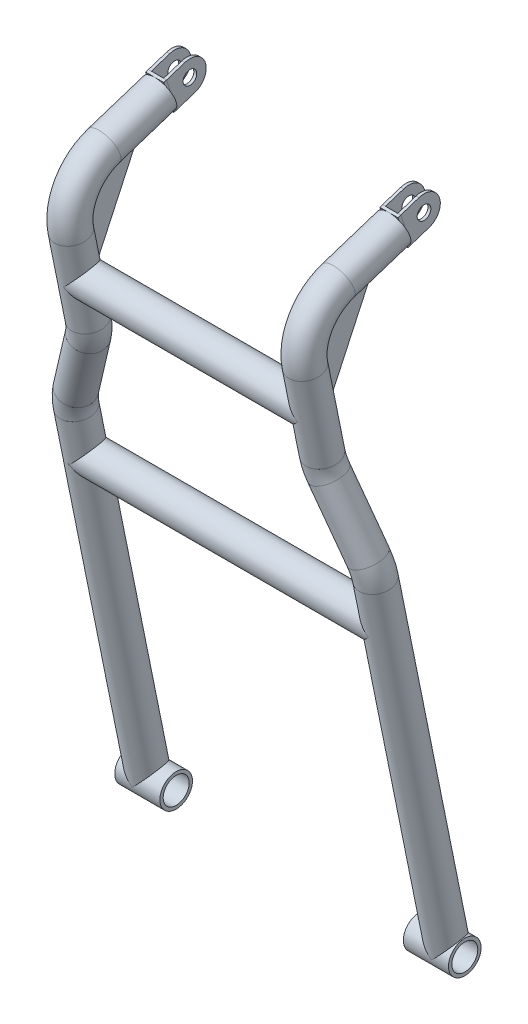
from build123d import *

# Parameters (mm, degrees)
SALIENTE_EXTRUIR2_DEPTH             = 17.7
SALIENTE_EXTRUIR2_DEPTH_BACK        = 28.6
CROQUIS9_R                          = 16.7
CROQUIS9_R_2                        = 13.32
CROQUIS17_R                         = 7
SALIENTE_EXTRUIR3_DEPTH             = 3
SALIENTE_EXTRUIR4_DEPTH             = 18.6
CROQUIS28_R                         = 7
SALIENTE_EXTRUIR6_DEPTH             = 3
MIEMBRO_START                       = 115.013486238
MIEMBRO_ESTRUCTURAL2_OUTLINE_R      = 16.7005
MIEMBRO_ESTRUCTURAL2_OUTLINE_R_2    = 13.3223
MIEMBRO_ESTRUCTURAL2_DEPTH          = 60
MIEMBRO_ESTRUCTURAL2_2_OUTLINE_R    = 16.7005
MIEMBRO_ESTRUCTURAL2_2_OUTLINE_R_2  = 13.3223
MIEMBRO_ESTRUCTURAL2_2_ANGLE        = 83.467742
MIEMBRO_START_2                     = 478.845731153
MIEMBRO_ESTRUCTURAL2_3_OUTLINE_R    = 16.7005
MIEMBRO_ESTRUCTURAL2_3_OUTLINE_R_2  = 13.3223
MIEMBRO_ESTRUCTURAL2_3_DEPTH        = 88.50498695
MIEMBRO_ESTRUCTURAL2_4_OUTLINE_R    = 16.7005
MIEMBRO_ESTRUCTURAL2_4_OUTLINE_R_2  = 13.3223
MIEMBRO_ESTRUCTURAL2_4_ANGLE        = 20.838652
MIEMBRO_START_3                     = -386.762506434
MIEMBRO_ESTRUCTURAL2_5_OUTLINE_R    = 16.7005
MIEMBRO_ESTRUCTURAL2_5_OUTLINE_R_2  = 13.3223
MIEMBRO_ESTRUCTURAL2_5_DEPTH        = 74.28752144
MIEMBRO_ESTRUCTURAL2_6_OUTLINE_R    = 16.7005
MIEMBRO_ESTRUCTURAL2_6_OUTLINE_R_2  = 13.3223
MIEMBRO_ESTRUCTURAL2_6_ANGLE        = 20.838652
MIEMBRO_ESTRUCTURAL2_7_OUTLINE_R    = 16.7005
MIEMBRO_ESTRUCTURAL2_7_OUTLINE_R_2  = 13.3223
MIEMBRO_ESTRUCTURAL2_7_DEPTH        = 371.496041626
MIEMBRO_START_4                     = -154.6
MIEMBRO_ESTRUCTURAL2_8_OUTLINE_R    = 16.7005
MIEMBRO_ESTRUCTURAL2_8_OUTLINE_R_2  = 13.3223
MIEMBRO_ESTRUCTURAL2_8_DEPTH        = 308.0000001
MIEMBRO_ESTRUCTURAL2_9_OUTLINE_W    = 16.7005
MIEMBRO_ESTRUCTURAL2_9_OUTLINE_H    = 33.514710476
MIEMBRO_START_5                     = -120
MIEMBRO_ESTRUCTURAL2_10_OUTLINE_R   = 16.7005
MIEMBRO_ESTRUCTURAL2_10_OUTLINE_R_2 = 13.3223
MIEMBRO_ESTRUCTURAL2_10_DEPTH       = 240.0000001
MIEMBRO_START_6                     = 505
MIEMBRO_ESTRUCTURAL2_11_DEPTH       = 36
SIMETR_A10_2_ANGLE                  = 180
SIMETR_A10_3_ANGLE                  = 172.2878654
SIMETR_A10_4_ANGLE                  = 180
SALIENTE_EXTRUIR7_DEPTH             = 1.5
CROQUIS38_R                         = 13.32
CORTAR_EXTRUIR1_DEPTH               = 752.917771395


with BuildPart() as part:
    # Croquis9 → Saliente-Extruir2 (new, two sides: drawn at the far end of the back side and taken through both)
    with BuildSketch(Plane(origin=(153.4, 0, 0), x_dir=(0, 0, -1), z_dir=(1, 0, 0)).offset(-SALIENTE_EXTRUIR2_DEPTH_BACK)):
        Circle(CROQUIS9_R)
        Circle(CROQUIS9_R_2, mode=Mode.SUBTRACT)
    extrude(amount=SALIENTE_EXTRUIR2_DEPTH + SALIENTE_EXTRUIR2_DEPTH_BACK)


with BuildPart() as body_2:
    # Simetría6: mirrored copy
    add(part.part.mirror(Plane(origin=(0, 0, 0), x_dir=(0, 0, 1), z_dir=(1, 0, 0))))


with BuildPart() as body_3:
    # Croquis17 → Saliente-Extruir3 (new body)
    with BuildSketch(Plane(origin=(126.3, 0, 0), x_dir=(0, 0, -1), z_dir=(1, 0, 0))):
        with BuildLine():
            ThreePointArc((0, 656.7), (-2.611948956, 656.494475519), (-5.159608157, 655.882960797))
            Line((-5.159608157, 655.882960797), (-23.914816954, 649.790297752))
            Line((-23.914816954, 649.790297752), (-13.595600641, 618.024376159))
            Line((-13.595600641, 618.024376159), (5.159608157, 624.117039203))
            ThreePointArc((5.159608157, 624.117039203), (16.494475519, 642.611948956), (0, 656.7))
        make_face()
        with Locations((0, 640)):
            Circle(CROQUIS17_R, mode=Mode.SUBTRACT)
    extrude(amount=SALIENTE_EXTRUIR3_DEPTH)


with BuildPart() as body_4:
    # Croquis25 → Saliente-Extruir4 (new body)
    with BuildSketch(Plane(origin=(129.3, 0, 0), x_dir=(0, 0, -1), z_dir=(1, 0, 0))):
        Polygon((-23.914816954, 649.790297752), (-13.595600641, 618.024376159), (-16.448827131, 617.097500442), (-26.768043444, 648.863422035), align=None)
    extrude(amount=-SALIENTE_EXTRUIR4_DEPTH)


with BuildPart() as body_5:
    # Croquis28 → Saliente-Extruir6 (new body)
    with BuildSketch(Plane.ZY.offset(-110.7)):
        with BuildLine():
            Line((5.159608157, 655.882960797), (23.914816954, 649.790297752))
            Line((23.914816954, 649.790297752), (13.595600641, 618.024376159))
            Line((13.595600641, 618.024376159), (-5.159608157, 624.117039203))
            ThreePointArc((-5.159608157, 624.117039203), (-15.882960797, 645.159608157), (5.159608157, 655.882960797))
        make_face()
        with Locations((0, 640)):
            Circle(CROQUIS28_R, mode=Mode.SUBTRACT)
    extrude(amount=-SALIENTE_EXTRUIR6_DEPTH)


with BuildPart() as body_6:
    # Simetría8: mirrored copy
    add(body_4.part.mirror(Plane(origin=(0, 0, 0), x_dir=(0, 0, 1), z_dir=(1, 0, 0))))


with BuildPart() as body_7:
    # Simetr_a8 2: mirrored copy
    add(body_5.part.mirror(Plane(origin=(0, 0, 0), x_dir=(0, 0, 1), z_dir=(1, 0, 0))))


with BuildPart() as body_8:
    # Simetr_a8 3: mirrored copy
    add(body_3.part.mirror(Plane(origin=(0, 0, 0), x_dir=(0, 0, 1), z_dir=(1, 0, 0))))


with BuildPart() as body_9:
    # Miembro estructural2: read off the stored shape, not the designer's step
    # Miembro estructural2 outline → Miembro estructural2 (new body)
    with BuildSketch(Plane(origin=(0, 0, 0), x_dir=(1, 0, 0), z_dir=(0, 0.3089585722475161, -0.9510754968112555)).offset(MIEMBRO_START)):
        with Locations((120, -608.688317959)):
            Circle(MIEMBRO_ESTRUCTURAL2_OUTLINE_R)
        with Locations((120, -608.688317959)):
            Circle(MIEMBRO_ESTRUCTURAL2_OUTLINE_R_2, mode=Mode.SUBTRACT)
    extrude(amount=MIEMBRO_ESTRUCTURAL2_DEPTH)


with BuildPart() as body_10:
    # Miembro estructural2 2 outline → Miembro estructural2 2 (revolve)
    with BuildSketch(Plane(origin=(0, 566.128311666, 62.977869626), x_dir=(0, 0.9510754968112548, 0.30895857224751816), z_dir=(0, 0.30895857224751816, -0.9510754968112548))):
        with Locations((50.8, 120)):
            Circle(MIEMBRO_ESTRUCTURAL2_2_OUTLINE_R)
        with Locations((50.8, 120)):
            Circle(MIEMBRO_ESTRUCTURAL2_2_OUTLINE_R_2, mode=Mode.SUBTRACT)
    revolve(axis=Axis((0, 566.128311666, 62.977869626), (1, 0, 0)), revolution_arc=MIEMBRO_ESTRUCTURAL2_2_ANGLE)


with BuildPart() as body_11:
    # Miembro estructural2 3 outline → Miembro estructural2 3 (new body)
    with BuildSketch(Plane(origin=(0, 0, 0), x_dir=(1, 0, 0), z_dir=(0, 0.9800490052183392, 0.19875599958377102)).offset(MIEMBRO_START_2)):
        with Locations((120, 0)):
            Circle(MIEMBRO_ESTRUCTURAL2_3_OUTLINE_R)
        with Locations((120, 0)):
            Circle(MIEMBRO_ESTRUCTURAL2_3_OUTLINE_R_2, mode=Mode.SUBTRACT)
    extrude(amount=MIEMBRO_ESTRUCTURAL2_3_DEPTH)


with BuildPart() as body_12:
    # Miembro estructural2 4 outline → Miembro estructural2 4 (revolve)
    with BuildSketch(Plane(origin=(170.8, 469.29228247, 95.173461942), x_dir=(-0.9345859099311943, -0.34864019408516855, -0.07070496465127267), z_dir=(0.355737511317097, -0.9159399913191433, -0.1857545567252827))):
        with Locations((50.8, 0)):
            Circle(MIEMBRO_ESTRUCTURAL2_4_OUTLINE_R)
        with Locations((50.8, 0)):
            Circle(MIEMBRO_ESTRUCTURAL2_4_OUTLINE_R_2, mode=Mode.SUBTRACT)
    revolve(axis=Axis((170.8, 469.29228247, 95.173461942), (0, 0.19875599958377105, -0.9800490052183393)), revolution_arc=MIEMBRO_ESTRUCTURAL2_4_ANGLE)


with BuildPart() as body_13:
    # Miembro estructural2 5 outline → Miembro estructural2 5 (new body)
    with BuildSketch(Plane(origin=(0, 0, 0), x_dir=(0.9345859099311962, 0.3486401940851637, 0.07070496465127166), z_dir=(0.355737511317092, -0.915939991319145, -0.185754556725283)).offset(MIEMBRO_START_3)):
        with Locations((279.170662122, 0)):
            Circle(MIEMBRO_ESTRUCTURAL2_5_OUTLINE_R)
        with Locations((279.170662122, 0)):
            Circle(MIEMBRO_ESTRUCTURAL2_5_OUTLINE_R_2, mode=Mode.SUBTRACT)
    extrude(amount=MIEMBRO_ESTRUCTURAL2_5_DEPTH)


with BuildPart() as body_14:
    # Miembro estructural2 6 outline → Miembro estructural2 6 (revolve)
    with BuildSketch(Plane(origin=(97.6, 364.084326038, 73.837067095), x_dir=(0.9345859099311951, 0.34864019408516644, 0.07070496465127224), z_dir=(-0.35573751131709486, 0.915939991319144, 0.18575455672528288))):
        with Locations((55.8, 0)):
            Circle(MIEMBRO_ESTRUCTURAL2_6_OUTLINE_R)
        with Locations((55.8, 0)):
            Circle(MIEMBRO_ESTRUCTURAL2_6_OUTLINE_R_2, mode=Mode.SUBTRACT)
    revolve(axis=Axis((97.6, 364.084326038, 73.837067095), (0, 0.19875599958377105, -0.9800490052183392)), revolution_arc=MIEMBRO_ESTRUCTURAL2_6_ANGLE)


with BuildPart() as body_15:
    # Miembro estructural2 7 outline → Miembro estructural2 7 (new body)
    with BuildSketch(Plane(origin=(0, 0, 0), x_dir=(1, 0, 0), z_dir=(0, 0.9800490052183392, 0.19875599958377102))):
        with Locations((153.4, 0)):
            Circle(MIEMBRO_ESTRUCTURAL2_7_OUTLINE_R)
        with Locations((153.4, 0)):
            Circle(MIEMBRO_ESTRUCTURAL2_7_OUTLINE_R_2, mode=Mode.SUBTRACT)
    extrude(amount=MIEMBRO_ESTRUCTURAL2_7_DEPTH)


with BuildPart() as body_16:
    # Miembro estructural2 8 outline → Miembro estructural2 8 (new body)
    with BuildSketch(Plane.YZ.offset(MIEMBRO_START_4)):
        with Locations((318.490075845, 64.590457258)):
            Circle(MIEMBRO_ESTRUCTURAL2_8_OUTLINE_R)
        with Locations((318.490075845, 64.590457258)):
            Circle(MIEMBRO_ESTRUCTURAL2_8_OUTLINE_R_2, mode=Mode.SUBTRACT)
    extrude(amount=MIEMBRO_ESTRUCTURAL2_8_DEPTH)

    # Miembro estructural2 9 outline → Miembro estructural2 9 (revolve, cut)
    with BuildSketch(Plane(origin=(153.4, 0, 0), x_dir=(1, 0, 0), z_dir=(0, -0.19875599958377102, 0.9800490052183392))):
        with Locations((8.35025, 324.9736229)):
            Rectangle(MIEMBRO_ESTRUCTURAL2_9_OUTLINE_W, MIEMBRO_ESTRUCTURAL2_9_OUTLINE_H)
    revolve(axis=Axis((153.4, 0, 0), (0, 0.9800490052183392, 0.19875599958377102)), mode=Mode.SUBTRACT)


with BuildPart() as body_17:
    # Miembro estructural2 10 outline → Miembro estructural2 10 (new body)
    with BuildSketch(Plane.YZ.offset(MIEMBRO_START_5)):
        with Locations((512.661894678, 103.968910516)):
            Circle(MIEMBRO_ESTRUCTURAL2_10_OUTLINE_R)
        with Locations((512.661894678, 103.968910516)):
            Circle(MIEMBRO_ESTRUCTURAL2_10_OUTLINE_R_2, mode=Mode.SUBTRACT)
    extrude(amount=MIEMBRO_ESTRUCTURAL2_10_DEPTH)

    # Miembro estructural2 11 outline → Miembro estructural2 11 (cut)
    with BuildSketch(Plane(origin=(0, 0, 0), x_dir=(1, 0, 0), z_dir=(0, 0.9800490052183392, 0.19875599958377102)).offset(MIEMBRO_START_6)):
        with BuildLine():
            Line((120, -16.7005), (120, 16.7005))
            ThreePointArc((120, 16.7005), (103.2995, 0), (120, -16.7005))
        make_face()
    extrude(amount=MIEMBRO_ESTRUCTURAL2_11_DEPTH, mode=Mode.SUBTRACT)


with BuildPart() as body_18:
    # Simetría10: read off the stored shape, not the designer's step
    # Simetría10: copy of body 15
    add(body_15.part.moved(Location((-306.8, 0, 0))))


with BuildPart() as body_19:
    # Simetr_a10 2: copy of body 14
    add(body_14.part.rotate(Axis((0, 0, 0), (0, 0.9800490052, 0.1987559996)), SIMETR_A10_2_ANGLE))


with BuildPart() as body_20:
    # Simetr_a10 3: copy of body 13
    add(body_13.part.moved(Location((-2.7018963, 6.9567443, -39.4775036))).rotate(Axis((0, 0, 0), (0, 0.9848256855, 0.1735464465)), SIMETR_A10_3_ANGLE))


with BuildPart() as body_21:
    # Simetr_a10 4: copy of body 12
    add(body_12.part.rotate(Axis((0, 0, 0), (0, 0.9800490052, 0.1987559996)), SIMETR_A10_4_ANGLE))


with BuildPart() as body_22:
    # Simetr_a10 5: copy of body 11
    add(body_11.part.moved(Location((-240, 0, 0))))


with BuildPart() as body_23:
    # Simetr_a10 6: copy of body 10
    add(body_10.part.moved(Location((-240, 0, 0))))


with BuildPart() as body_24:
    # Simetr_a10 7: mirrored copy
    add(body_9.part.mirror(Plane.YZ))


with BuildPart() as body_25:
    # Croquis37 → Saliente-Extruir7 (new, symmetric)
    with BuildSketch(Plane(origin=(120, 0, 0), x_dir=(0, 0, -1), z_dir=(1, 0, 0))):
        with BuildLine():
            Line((-73.51320246, 598.559510569), (-44.980937556, 607.828267737))
            Line((-44.980937556, 607.828267737), (-87.601602105, 515.981219249))
            Line((-87.601602105, 515.981219249), (-96.397050679, 559.350831458))
            ThreePointArc((-96.397050679, 559.350831458), (-92.428335704, 583.31685285), (-73.51320246, 598.559510569))
        make_face()
    extrude(amount=SALIENTE_EXTRUIR7_DEPTH, both=True)


with BuildPart() as body_26:
    # Simetría11: mirrored copy
    add(body_25.part.mirror(Plane(origin=(0, 0, 0), x_dir=(0, 0, 1), z_dir=(1, 0, 0))))


with BuildPart() as cortar_extruir1_tool:
    # Croquis38 → Cortar-Extruir1 (new, through all)
    with BuildSketch(Plane(origin=(171.1, 0, 0), x_dir=(0, 0, -1), z_dir=(1, 0, 0))):
        Circle(CROQUIS38_R)
    extrude(amount=-CORTAR_EXTRUIR1_DEPTH)


with BuildPart() as body_15_1:
    add(body_15.part)

    # Cortar-Extruir1: cut by cortar_extruir1_tool
    add(cortar_extruir1_tool.part, mode=Mode.SUBTRACT)


with BuildPart() as body_18_1:
    add(body_18.part)

    # Cortar-Extruir1: cut by cortar_extruir1_tool
    add(cortar_extruir1_tool.part, mode=Mode.SUBTRACT)


solid = Compound([part.part, body_2.part, body_3.part, body_4.part, body_5.part, body_6.part, body_7.part, body_8.part, body_9.part, body_10.part, body_11.part, body_12.part, body_13.part, body_14.part, body_16.part, body_17.part, body_19.part, body_20.part, body_21.part, body_22.part, body_23.part, body_24.part, body_25.part, body_26.part, body_15_1.part, body_18_1.part])
